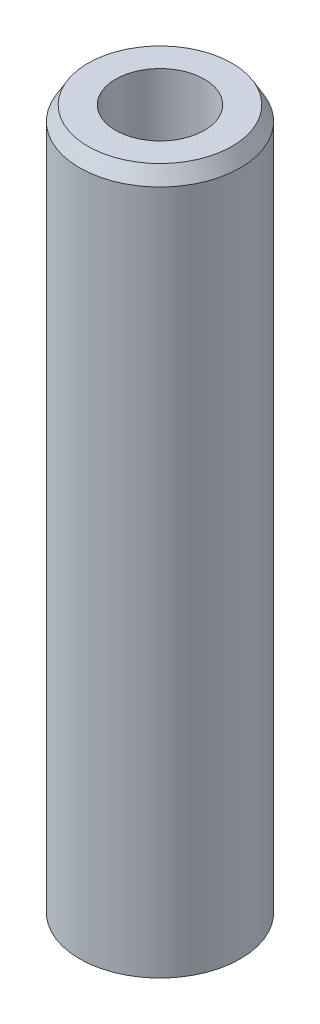
from build123d import *
from OCP.BRepFilletAPI import BRepFilletAPI_MakeChamfer

# Parameters (mm, degrees)
SKETCH1_R           = 12.5
BOSS_EXTRUDE1_DEPTH = 110.078650769
SKETCH2_R           = 6.899956576
CUT_EXTRUDE1_DEPTH  = 112.489054867
CHAMFER1_SIZE       = 2.246210213
CHAMFER1_SIZE2      = 1.296850071


with BuildPart() as part:
    # Sketch1 → Boss-Extrude1 (new body)
    with BuildSketch(Plane(origin=(0, 0, 0), x_dir=(1, 0, 0), z_dir=(0, 1, 0))):
        Circle(SKETCH1_R)
    extrude(amount=BOSS_EXTRUDE1_DEPTH)

    # Sketch2 → Cut-Extrude1 (cut, through all)
    with BuildSketch(Plane(origin=(0, 0, 0), x_dir=(1, 0, 0), z_dir=(0, 1, 0))):
        Circle(SKETCH2_R)
    extrude(amount=CUT_EXTRUDE1_DEPTH, mode=Mode.SUBTRACT)

    # Chamfer1: one chamfer whose edges measure the first distance from different faces: ONE call of the kernel's chamfer builder (chamfer() names one face for all edges)
    chamfer1_edges_1 = [part.edges().sort_by_distance(p)[0] for p in [
        (-12.5, 110.078650769, 0),
    ]]
    chamfer1_side_1 = [part.faces().sort_by_distance(p)[0] for p in [
        (-12.5, 55.039325384, 0),
    ]]
    chamfer1_edges_2 = [part.edges().sort_by_distance(p)[0] for p in [
        (-12.5, 0, 0),
    ]]
    chamfer1_side_2 = [part.faces().sort_by_distance(p)[0] for p in [
        (-12.146446609, 0, 0),
    ]]
    chamfer1 = BRepFilletAPI_MakeChamfer(part.part.solid().wrapped)
    for e in chamfer1_edges_1:
        chamfer1.Add(CHAMFER1_SIZE, CHAMFER1_SIZE2, e.wrapped, chamfer1_side_1[0].wrapped)  # the first distance lies on this face
    for e in chamfer1_edges_2:
        chamfer1.Add(CHAMFER1_SIZE, CHAMFER1_SIZE2, e.wrapped, chamfer1_side_2[0].wrapped)  # the first distance lies on this face
    add(Compound.cast(chamfer1.Shape()), mode=Mode.REPLACE)


solid = part.part
